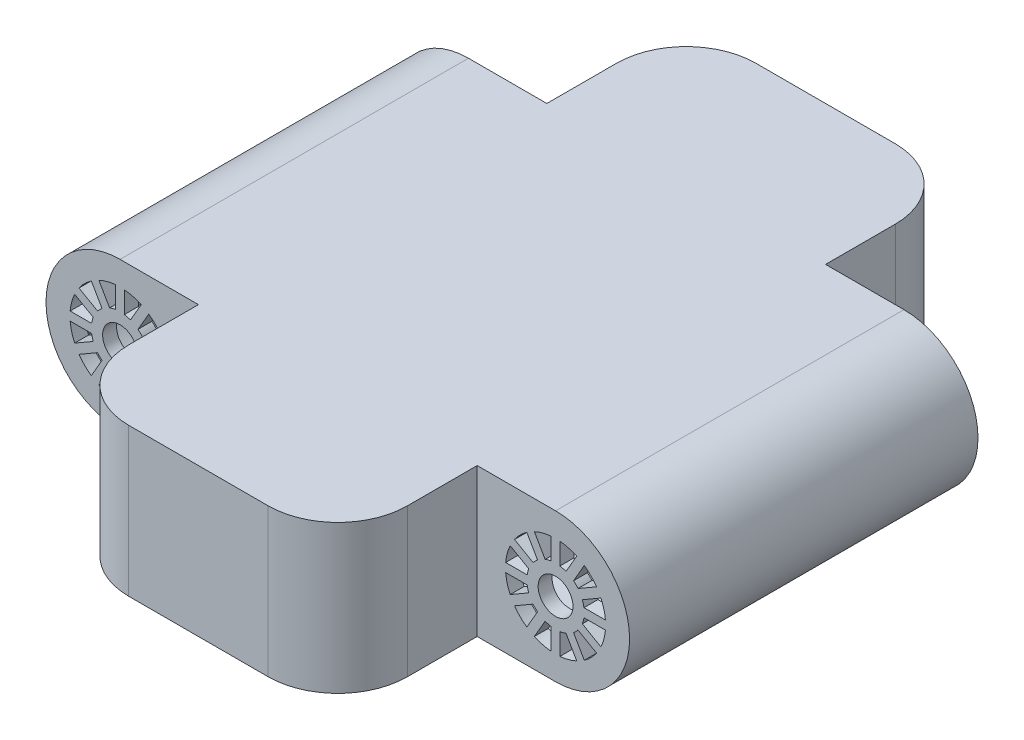
from build123d import *
from build123d.topology import SkipClean

# Parameters (mm, degrees)
BOSS_EXTRUDE3_DEPTH = 42.5
SKETCH1_R           = 10
CUT_EXTRUDE1_DEPTH  = 200
BOSS_EXTRUDE4_START = -200
BOSS_EXTRUDE4_DEPTH = 200
SKETCH1_12_W        = 160
SKETCH1_12_H        = 2.5
BOSS_EXTRUDE5_DEPTH = 80
SKETCH1_13_W        = 160
SKETCH1_13_H        = 2.5
BOSS_EXTRUDE6_DEPTH = 272
FILLET1_R           = 40


# Read off the part's stored shape, not the designer's step: Boss-Extrude4
with BuildPart() as part:
    # Sketch3 → Boss-Extrude3 (new, symmetric)
    with BuildSketch(Plane(origin=(0, 0, 0), x_dir=(1, 0, 0), z_dir=(0, 1, 0))):
        Polygon((-42.5, 0), (-42.5, 200), (45, 200), (45, 280), (205, 280), (205, 200), (292.5, 200), (292.5, 0), (205, 0), (205, -80), (45, -80), (45, 0), align=None)
        Polygon((53, 272), (197, 272), (197, 192), (284.5, 192), (284.5, 8), (197, 8), (197, -72), (53, -72), (53, 8), (-34.5, 8), (-34.5, 192), (53, 192), align=None, mode=Mode.SUBTRACT)
    extrude(amount=BOSS_EXTRUDE3_DEPTH, both=True)

    # Sketch1 → Cut-Extrude1 (cut)
    with BuildSketch(Plane.XY):
        with BuildLine():
            ThreePointArc((-42.5, 0), (-30.0520382, 30.0520382), (0, 42.5))
            Line((0, 42.5), (-42.5, 42.5))
            Line((-42.5, 42.5), (-42.5, 0))
        make_face()
        with BuildLine():
            ThreePointArc((0, -42.5), (-30.0520382, -30.0520382), (-42.5, 0))
            Line((-42.5, 0), (-42.5, -42.5))
            Line((-42.5, -42.5), (0, -42.5))
        make_face()
        with BuildLine():
            ThreePointArc((-10.319816725, 12.874446892), (-11.66726189, 11.66726189), (-12.874446892, 10.319816725))
            Line((-12.874446892, 10.319816725), (-23.553918541, 16.485612556))
            ThreePointArc((-23.553918541, 16.485612556), (-20.329319959, 20.329319959), (-16.485612556, 23.553918541))
            Line((-16.485612556, 23.553918541), (-10.319816725, 12.874446892))
        make_face()
        with BuildLine():
            Line((-26.053918541, 12.155485537), (-15.374446892, 5.989689706))
            ThreePointArc((-15.374446892, 5.989689706), (-15.937776134, 4.270514244), (-16.30950643, 2.5))
            Line((-16.30950643, 2.5), (-28.641098093, 2.5))
            ThreePointArc((-28.641098093, 2.5), (-27.770367506, 7.441047547), (-26.053918541, 12.155485537))
        make_face()
        with BuildLine():
            Line((-28.641098093, -2.5), (-16.30950643, -2.5))
            ThreePointArc((-16.30950643, -2.5), (-15.937776134, -4.270514244), (-15.374446892, -5.989689706))
            Line((-15.374446892, -5.989689706), (-26.053918541, -12.155485537))
            ThreePointArc((-26.053918541, -12.155485537), (-27.770367506, -7.441047547), (-28.641098093, -2.5))
        make_face()
        with BuildLine():
            Line((-23.553918541, -16.485612556), (-12.874446892, -10.319816725))
            ThreePointArc((-12.874446892, -10.319816725), (-11.66726189, -11.66726189), (-10.319816725, -12.874446892))
            Line((-10.319816725, -12.874446892), (-16.485612556, -23.553918541))
            ThreePointArc((-16.485612556, -23.553918541), (-20.329319959, -20.329319959), (-23.553918541, -16.485612556))
        make_face()
        with BuildLine():
            Line((-12.155485537, -26.053918541), (-5.989689706, -15.374446892))
            ThreePointArc((-5.989689706, -15.374446892), (-4.270514244, -15.937776134), (-2.5, -16.30950643))
            Line((-2.5, -16.30950643), (-2.5, -28.641098093))
            ThreePointArc((-2.5, -28.641098093), (-7.441047547, -27.770367506), (-12.155485537, -26.053918541))
        make_face()
        with BuildLine():
            Line((2.5, -28.641098093), (2.5, -16.30950643))
            ThreePointArc((2.5, -16.30950643), (4.270514244, -15.937776134), (5.989689706, -15.374446892))
            Line((5.989689706, -15.374446892), (12.155485537, -26.053918541))
            ThreePointArc((12.155485537, -26.053918541), (7.441047547, -27.770367506), (2.5, -28.641098093))
        make_face()
        with BuildLine():
            Line((16.485612556, -23.553918541), (10.319816725, -12.874446892))
            ThreePointArc((10.319816725, -12.874446892), (11.66726189, -11.66726189), (12.874446892, -10.319816725))
            Line((12.874446892, -10.319816725), (23.553918541, -16.485612556))
            ThreePointArc((23.553918541, -16.485612556), (20.329319959, -20.329319959), (16.485612556, -23.553918541))
        make_face()
        with BuildLine():
            Line((26.053918541, -12.155485537), (15.374446892, -5.989689706))
            ThreePointArc((15.374446892, -5.989689706), (15.937776134, -4.270514244), (16.30950643, -2.5))
            Line((16.30950643, -2.5), (28.641098093, -2.5))
            ThreePointArc((28.641098093, -2.5), (27.770367506, -7.441047547), (26.053918541, -12.155485537))
        make_face()
        with BuildLine():
            Line((28.641098093, 2.5), (16.30950643, 2.5))
            ThreePointArc((16.30950643, 2.5), (15.937776134, 4.270514244), (15.374446892, 5.989689706))
            Line((15.374446892, 5.989689706), (26.053918541, 12.155485537))
            ThreePointArc((26.053918541, 12.155485537), (27.770367506, 7.441047547), (28.641098093, 2.5))
        make_face()
        with BuildLine():
            Line((23.553918541, 16.485612556), (12.874446892, 10.319816725))
            ThreePointArc((12.874446892, 10.319816725), (11.66726189, 11.66726189), (10.319816725, 12.874446892))
            Line((10.319816725, 12.874446892), (16.485612556, 23.553918541))
            ThreePointArc((16.485612556, 23.553918541), (20.329319959, 20.329319959), (23.553918541, 16.485612556))
        make_face()
        with BuildLine():
            Line((12.155485537, 26.053918541), (5.989689706, 15.374446892))
            ThreePointArc((5.989689706, 15.374446892), (4.270514244, 15.937776134), (2.5, 16.30950643))
            Line((2.5, 16.30950643), (2.5, 28.641098093))
            ThreePointArc((2.5, 28.641098093), (7.441047547, 27.770367506), (12.155485537, 26.053918541))
        make_face()
        with BuildLine():
            Line((-2.5, 28.641098093), (-2.5, 16.30950643))
            ThreePointArc((-2.5, 16.30950643), (-4.270514244, 15.937776134), (-5.989689706, 15.374446892))
            Line((-5.989689706, 15.374446892), (-12.155485537, 26.053918541))
            ThreePointArc((-12.155485537, 26.053918541), (-7.441047547, 27.770367506), (-2.5, 28.641098093))
        make_face()
        Circle(SKETCH1_R)
        with BuildLine():
            Line((292.5, 42.5), (250, 42.5))
            ThreePointArc((250, 42.5), (280.0520382, 30.0520382), (292.5, 0))
            Line((292.5, 0), (292.5, 42.5))
        make_face()
        with BuildLine():
            Line((292.5, -42.5), (292.5, 0))
            ThreePointArc((292.5, 0), (280.0520382, -30.0520382), (250, -42.5))
            Line((250, -42.5), (292.5, -42.5))
        make_face()
        with BuildLine():
            Line((273.553918541, -16.485612556), (262.874446892, -10.319816725))
            ThreePointArc((262.874446892, -10.319816725), (261.66726189, -11.66726189), (260.319816725, -12.874446892))
            Line((260.319816725, -12.874446892), (266.485612556, -23.553918541))
            ThreePointArc((266.485612556, -23.553918541), (270.329319959, -20.329319959), (273.553918541, -16.485612556))
        make_face()
        with BuildLine():
            Line((262.155485537, -26.053918541), (255.989689706, -15.374446892))
            ThreePointArc((255.989689706, -15.374446892), (254.270514244, -15.937776134), (252.5, -16.30950643))
            Line((252.5, -16.30950643), (252.5, -28.641098093))
            ThreePointArc((252.5, -28.641098093), (257.441047547, -27.770367506), (262.155485537, -26.053918541))
        make_face()
        with BuildLine():
            Line((247.5, -28.641098093), (247.5, -16.30950643))
            ThreePointArc((247.5, -16.30950643), (245.729485756, -15.937776134), (244.010310294, -15.374446892))
            Line((244.010310294, -15.374446892), (237.844514463, -26.053918541))
            ThreePointArc((237.844514463, -26.053918541), (242.558952453, -27.770367506), (247.5, -28.641098093))
        make_face()
        with BuildLine():
            Line((233.514387444, -23.553918541), (239.680183275, -12.874446892))
            ThreePointArc((239.680183275, -12.874446892), (238.33273811, -11.66726189), (237.125553108, -10.319816725))
            Line((237.125553108, -10.319816725), (226.446081459, -16.485612556))
            ThreePointArc((226.446081459, -16.485612556), (229.670680041, -20.329319959), (233.514387444, -23.553918541))
        make_face()
        with BuildLine():
            Line((223.946081459, -12.155485537), (234.625553108, -5.989689706))
            ThreePointArc((234.625553108, -5.989689706), (234.062223866, -4.270514244), (233.69049357, -2.5))
            Line((233.69049357, -2.5), (221.358901907, -2.5))
            ThreePointArc((221.358901907, -2.5), (222.229632494, -7.441047547), (223.946081459, -12.155485537))
        make_face()
        with BuildLine():
            Line((221.358901907, 2.5), (233.69049357, 2.5))
            ThreePointArc((233.69049357, 2.5), (234.062223866, 4.270514244), (234.625553108, 5.989689706))
            Line((234.625553108, 5.989689706), (223.946081459, 12.155485537))
            ThreePointArc((223.946081459, 12.155485537), (222.229632494, 7.441047547), (221.358901907, 2.5))
        make_face()
        with BuildLine():
            Line((226.446081459, 16.485612556), (237.125553108, 10.319816725))
            ThreePointArc((237.125553108, 10.319816725), (238.33273811, 11.66726189), (239.680183275, 12.874446892))
            Line((239.680183275, 12.874446892), (233.514387444, 23.553918541))
            ThreePointArc((233.514387444, 23.553918541), (229.670680041, 20.329319959), (226.446081459, 16.485612556))
        make_face()
        with BuildLine():
            Line((237.844514463, 26.053918541), (244.010310294, 15.374446892))
            ThreePointArc((244.010310294, 15.374446892), (245.729485756, 15.937776134), (247.5, 16.30950643))
            Line((247.5, 16.30950643), (247.5, 28.641098093))
            ThreePointArc((247.5, 28.641098093), (242.558952453, 27.770367506), (237.844514463, 26.053918541))
        make_face()
        with BuildLine():
            Line((252.5, 28.641098093), (252.5, 16.30950643))
            ThreePointArc((252.5, 16.30950643), (254.270514244, 15.937776134), (255.989689706, 15.374446892))
            Line((255.989689706, 15.374446892), (262.155485537, 26.053918541))
            ThreePointArc((262.155485537, 26.053918541), (257.441047547, 27.770367506), (252.5, 28.641098093))
        make_face()
        with BuildLine():
            ThreePointArc((266.485612556, 23.553918541), (270.329319959, 20.329319959), (273.553918541, 16.485612556))
            Line((273.553918541, 16.485612556), (262.874446892, 10.319816725))
            ThreePointArc((262.874446892, 10.319816725), (261.66726189, 11.66726189), (260.319816725, 12.874446892))
            Line((260.319816725, 12.874446892), (266.485612556, 23.553918541))
        make_face()
        with BuildLine():
            Line((276.053918541, 12.155485537), (265.374446892, 5.989689706))
            ThreePointArc((265.374446892, 5.989689706), (265.937776134, 4.270514244), (266.30950643, 2.5))
            Line((266.30950643, 2.5), (278.641098093, 2.5))
            ThreePointArc((278.641098093, 2.5), (277.770367506, 7.441047547), (276.053918541, 12.155485537))
        make_face()
        with Locations((250, 0)):
            Circle(SKETCH1_R)
        with BuildLine():
            Line((278.641098093, -2.5), (266.30950643, -2.5))
            ThreePointArc((266.30950643, -2.5), (265.937776134, -4.270514244), (265.374446892, -5.989689706))
            Line((265.374446892, -5.989689706), (276.053918541, -12.155485537))
            ThreePointArc((276.053918541, -12.155485537), (277.770367506, -7.441047547), (278.641098093, -2.5))
        make_face()
    extrude(amount=-CUT_EXTRUDE1_DEPTH, mode=Mode.SUBTRACT)

    # Boss-Extrude4 outline → Boss-Extrude4 (add)
    with SkipClean():  # the faces are left unmerged after this step: merging them gives an invalid solid
        with BuildSketch(Plane.XY.offset(BOSS_EXTRUDE4_START)):
            with BuildLine():
                ThreePointArc((0, 42.5), (-19.383340013, 37.822428927), (-34.5, 24.819347292))
                Line((-34.5, 24.819347292), (-34.5, 20.24228248))
                ThreePointArc((-34.5, 20.24228248), (-19.878489641, 34.710886615), (0, 40))
                Line((0, 40), (250, 40))
                ThreePointArc((250, 40), (269.878489641, 34.710886615), (284.5, 20.24228248))
                Line((284.5, 20.24228248), (284.5, 24.819347292))
                ThreePointArc((284.5, 24.819347292), (269.383340013, 37.822428927), (250, 42.5))
                Line((250, 42.5), (0, 42.5))
            make_face()
            with BuildLine():
                Line((-34.5, -20.24228248), (-34.5, -24.819347292))
                ThreePointArc((-34.5, -24.819347292), (-19.383340013, -37.822428927), (0, -42.5))
                Line((0, -42.5), (250, -42.5))
                ThreePointArc((250, -42.5), (269.383340013, -37.822428927), (284.5, -24.819347292))
                Line((284.5, -24.819347292), (284.5, -20.24228248))
                ThreePointArc((284.5, -20.24228248), (269.878489641, -34.710886615), (250, -40))
                Line((250, -40), (0, -40))
                ThreePointArc((0, -40), (-19.878489641, -34.710886615), (-34.5, -20.24228248))
            make_face()
        extrude(amount=BOSS_EXTRUDE4_DEPTH)

    # Sketch1<12> → Boss-Extrude5 (add)
    with SkipClean():  # the faces are left unmerged after this step: merging them gives an invalid solid
        with BuildSketch(Plane.XY):
            with Locations((125, 41.25)):
                Rectangle(SKETCH1_12_W, SKETCH1_12_H)
            with Locations((125, -41.25)):
                Rectangle(SKETCH1_12_W, SKETCH1_12_H)
        extrude(amount=BOSS_EXTRUDE5_DEPTH)

    # Sketch1<13> → Boss-Extrude6 (add)
    with SkipClean():  # the faces are left unmerged after this step: merging them gives an invalid solid
        with BuildSketch(Plane.XY):
            with Locations((125, 41.25)):
                Rectangle(SKETCH1_13_W, SKETCH1_13_H)
            with Locations((125, -41.25)):
                Rectangle(SKETCH1_13_W, SKETCH1_13_H)
        extrude(amount=-BOSS_EXTRUDE6_DEPTH)

    # Fillet1
    # the kernel refuses this fillet: 40 mm, written as the material it adds along each edge
    with BuildSketch(Plane(origin=(53, 40, 72), x_dir=(0, 0, -1), z_dir=(0, -1, 0)), Plane(origin=(197, 40, -272), x_dir=(0, 0, 1), z_dir=(0, -1, 0)), Plane(origin=(53, -40, -272), x_dir=(0, 0, 1), z_dir=(0, 1, 0))) as fillet1_piece_1:
        with BuildLine():
            CenterArc((FILLET1_R, FILLET1_R), FILLET1_R, 180, 90)
            Line((0, FILLET1_R), (0, 0))
            Line((0, 0), (FILLET1_R, 0))
        make_face()
    extrude(amount=80)
    with BuildSketch(Plane(origin=(197, 40, 72), x_dir=(0, 0, -1), z_dir=(0, -1, 0))) as fillet1_piece_2:
        with BuildLine():
            CenterArc((FILLET1_R, -FILLET1_R), FILLET1_R, 90, 90)
            Line((0, -FILLET1_R), (0, 0))
            Line((0, 0), (FILLET1_R, 0))
        make_face()
    extrude(amount=80)
    # the kernel refuses this fillet: 40 mm, written as the material it takes off along each edge
    with BuildSketch(Plane(origin=(45, 142.5, -280), x_dir=(0, 0, 1), z_dir=(0, -1, 0)), Plane(origin=(205, 142.5, -280), x_dir=(-1, 0, 0), z_dir=(0, -1, 0))) as fillet1_2_piece_1:
        with BuildLine():
            CenterArc((FILLET1_R, -FILLET1_R), FILLET1_R, 90, 90)
            Line((0, -FILLET1_R), (0, 0))
            Line((0, 0), (FILLET1_R, 0))
        make_face()
    extrude(amount=285, mode=Mode.SUBTRACT)
    with BuildSketch(Plane(origin=(205, 40, 80), x_dir=(-1, 0, 0), z_dir=(0, -1, 0))) as fillet1_2_piece_2:
        with BuildLine():
            CenterArc((FILLET1_R, FILLET1_R), FILLET1_R, 180, 90)
            Line((0, FILLET1_R), (0, 0))
            Line((0, 0), (FILLET1_R, 0))
        make_face()
    extrude(amount=80, mode=Mode.SUBTRACT)
    with BuildSketch(Plane(origin=(45, -40, 80), x_dir=(0, 0, -1), z_dir=(0, 1, 0))) as fillet1_2_piece_3:
        with BuildLine():
            CenterArc((FILLET1_R, -FILLET1_R), FILLET1_R, 90, 90)
            Line((0, -FILLET1_R), (0, 0))
            Line((0, 0), (FILLET1_R, 0))
        make_face()
    extrude(amount=80, mode=Mode.SUBTRACT)
    with BuildSketch(Plane(origin=(45, -142.5, 80), x_dir=(0, 0, -1), z_dir=(0, 1, 0)), Plane(origin=(45, 40, 80), x_dir=(0, 0, -1), z_dir=(0, 1, 0))) as fillet1_2_piece_4:
        with BuildLine():
            CenterArc((FILLET1_R, -FILLET1_R), FILLET1_R, 90, 90)
            Line((0, -FILLET1_R), (0, 0))
            Line((0, 0), (FILLET1_R, 0))
        make_face()
    extrude(amount=102.5, mode=Mode.SUBTRACT)
    with BuildSketch(Plane(origin=(205, 142.5, 80), x_dir=(-1, 0, 0), z_dir=(0, -1, 0)), Plane(origin=(205, -40, 80), x_dir=(-1, 0, 0), z_dir=(0, -1, 0))) as fillet1_2_piece_5:
        with BuildLine():
            CenterArc((FILLET1_R, FILLET1_R), FILLET1_R, 180, 90)
            Line((0, FILLET1_R), (0, 0))
            Line((0, 0), (FILLET1_R, 0))
        make_face()
    extrude(amount=102.5, mode=Mode.SUBTRACT)


solid = part.part
